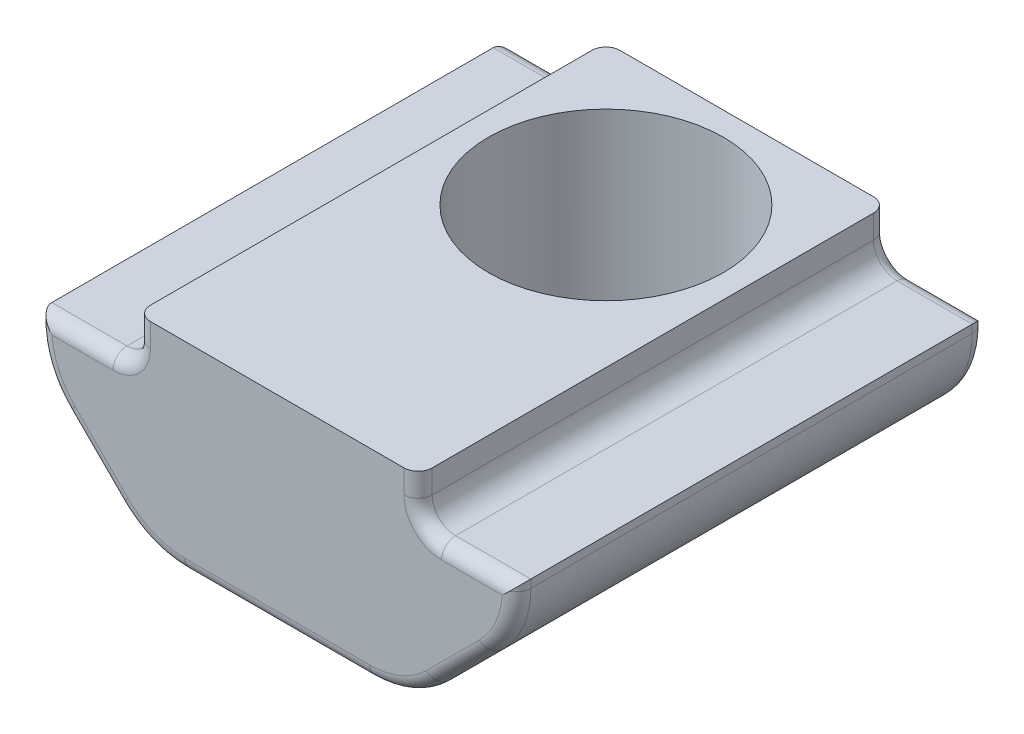
from build123d import *

# Parameters (mm, degrees)
EXTRUDE_1_DEPTH     = 10
FILLET_3_R          = 0.3
SKETCH_2_R          = 2.5
CUT_EXTRUDE_1_DEPTH = 6


with BuildPart() as part:
    # 草图1 → 凸台-拉伸1 (new body)
    with BuildSketch(Plane.XY):
        with BuildLine():
            Line((-3, 4.3), (3, 4.3))
            Line((3, 4.3), (3, 3.8))
            ThreePointArc((3, 3.8), (3.146446609, 3.446446609), (3.5, 3.3))
            Line((3.5, 3.3), (5.1, 3.3))
            Line((5.1, 3.3), (5.1, 3.128427125))
            ThreePointArc((5.1, 3.128427125), (4.947759065, 2.36306026), (4.514213562, 1.714213562))
            Line((4.514213562, 1.714213562), (3.385786438, 0.585786438))
            ThreePointArc((3.385786438, 0.585786438), (2.73693974, 0.152240935), (1.971572875, 0))
            Line((1.971572875, 0), (-1.971572875, 0))
            ThreePointArc((-1.971572875, 0), (-2.73693974, 0.152240935), (-3.385786438, 0.585786438))
            Line((-3.385786438, 0.585786438), (-4.514213562, 1.714213562))
            ThreePointArc((-4.514213562, 1.714213562), (-4.947759065, 2.36306026), (-5.1, 3.128427125))
            Line((-5.1, 3.128427125), (-5.1, 3.3))
            Line((-5.1, 3.3), (-3.5, 3.3))
            ThreePointArc((-3.5, 3.3), (-3.146446609, 3.446446609), (-3, 3.8))
            Line((-3, 3.8), (-3, 4.3))
        make_face()
    extrude(amount=EXTRUDE_1_DEPTH)

    # 圆角3
    # the kernel refuses this fillet: 0.3 mm, written as the material it takes off along each edge
    with BuildSketch(Plane(origin=(-3, 3.8, 10), x_dir=(0, 0, -1), z_dir=(0, 1, 0)), Plane(origin=(3, 5.05, 10), x_dir=(0, 0, -1), z_dir=(0, -1, 0))) as fillet_3_piece_1:
        with BuildLine():
            CenterArc((FILLET_3_R, -FILLET_3_R), FILLET_3_R, 90, 90)
            Line((0, -FILLET_3_R), (0, 0))
            Line((0, 0), (FILLET_3_R, 0))
        make_face()
    extrude(amount=1.25, mode=Mode.SUBTRACT)
    with BuildSketch(Plane(origin=(3, 5.05, 0), x_dir=(0, 0, 1), z_dir=(0, -1, 0)), Plane(origin=(-3, 3.8, 0), x_dir=(0, 0, 1), z_dir=(0, 1, 0))) as fillet_3_piece_2:
        with BuildLine():
            CenterArc((FILLET_3_R, FILLET_3_R), FILLET_3_R, 180, 90)
            Line((0, FILLET_3_R), (0, 0))
            Line((0, 0), (FILLET_3_R, 0))
        make_face()
    extrude(amount=1.25, mode=Mode.SUBTRACT)
    with BuildSketch(Plane(origin=(4.514213562, 1.714213562, 10), x_dir=(0, 0, -1), z_dir=(-0.7071067811865436, -0.7071067811865515, 0)), Plane(origin=(-3.385786438, 0.585786438, 10), x_dir=(0, 0, -1), z_dir=(-0.7071067811865436, 0.7071067811865515, 0))) as fillet_3_piece_3:
        with BuildLine():
            CenterArc((FILLET_3_R, -FILLET_3_R), FILLET_3_R, 90, 90)
            Line((0, -FILLET_3_R), (0, 0))
            Line((0, 0), (FILLET_3_R, 0))
        make_face()
    extrude(amount=1.595836944, mode=Mode.SUBTRACT)
    with BuildSketch(Plane(origin=(1.971572875, 2, 10), x_dir=(0.7071067811865542, -0.7071067811865409, 0), z_dir=(0.7071067811865409, 0.7071067811865542, 0))) as fillet_3_piece_4:
        with BuildLine():
            CenterArc((2 - FILLET_3_R, FILLET_3_R), FILLET_3_R, 270, 90)
            Line((2 - FILLET_3_R, 0), (2, 0))
            Line((2, 0), (2, FILLET_3_R))
        make_face()
    revolve(axis=Axis((1.971572875, 2, 10), (0, 0, -1)), revolution_arc=45, mode=Mode.SUBTRACT)
    with BuildSketch(Plane(origin=(1.971572875, 0, 10), x_dir=(0, 0, -1), z_dir=(-1, 0, 0))) as fillet_3_piece_5:
        with BuildLine():
            CenterArc((FILLET_3_R, -FILLET_3_R), FILLET_3_R, 90, 90)
            Line((0, -FILLET_3_R), (0, 0))
            Line((0, 0), (FILLET_3_R, 0))
        make_face()
    extrude(amount=3.943145751, mode=Mode.SUBTRACT)
    with BuildSketch(Plane(origin=(-1.971572875, 2, 10), x_dir=(0, -1, 0), z_dir=(1, 0, 0))) as fillet_3_piece_6:
        with BuildLine():
            CenterArc((2 - FILLET_3_R, FILLET_3_R), FILLET_3_R, 270, 90)
            Line((2 - FILLET_3_R, 0), (2, 0))
            Line((2, 0), (2, FILLET_3_R))
        make_face()
    revolve(axis=Axis((-1.971572875, 2, 10), (0, 0, -1)), revolution_arc=45, mode=Mode.SUBTRACT)
    with BuildSketch(Plane(origin=(-3.1, 3.128427125, 10), x_dir=(-0.7071067811865485, -0.7071067811865466, 0), z_dir=(0.7071067811865466, -0.7071067811865485, 0))) as fillet_3_piece_7:
        with BuildLine():
            CenterArc((2 - FILLET_3_R, FILLET_3_R), FILLET_3_R, 270, 90)
            Line((2 - FILLET_3_R, 0), (2, 0))
            Line((2, 0), (2, FILLET_3_R))
        make_face()
    revolve(axis=Axis((-3.1, 3.128427125, 10), (0, 0, -1)), revolution_arc=45, mode=Mode.SUBTRACT)
    with BuildSketch(Plane(origin=(-5.85, 3.3, 10), x_dir=(0, 0, -1), z_dir=(1, 0, 0)), Plane(origin=(3.5, 3.3, 10), x_dir=(0, 0, -1), z_dir=(1, 0, 0))) as fillet_3_piece_8:
        with BuildLine():
            CenterArc((FILLET_3_R, -FILLET_3_R), FILLET_3_R, 90, 90)
            Line((0, -FILLET_3_R), (0, 0))
            Line((0, 0), (FILLET_3_R, 0))
        make_face()
    extrude(amount=2.35, mode=Mode.SUBTRACT)
    with BuildSketch(Plane(origin=(-3.5, 3.8, 10), x_dir=(0, -1, 0), z_dir=(-1, 0, 0))) as fillet_3_piece_9:
        with BuildLine():
            CenterArc((0.5 + FILLET_3_R, -FILLET_3_R), FILLET_3_R, 90, 90)
            Line((0.5 + FILLET_3_R, 0), (0.5, 0))
            Line((0.5, 0), (0.5, -FILLET_3_R))
        make_face()
    revolve(axis=Axis((-3.5, 3.8, 10), (0, 0, 1)), revolution_arc=90, mode=Mode.SUBTRACT)
    with BuildSketch(Plane(origin=(3.5, 3.3, 0), x_dir=(0, 0, 1), z_dir=(1, 0, 0)), Plane(origin=(-5.85, 3.3, 0), x_dir=(0, 0, 1), z_dir=(1, 0, 0))) as fillet_3_piece_10:
        with BuildLine():
            CenterArc((FILLET_3_R, FILLET_3_R), FILLET_3_R, 180, 90)
            Line((0, FILLET_3_R), (0, 0))
            Line((0, 0), (FILLET_3_R, 0))
        make_face()
    extrude(amount=2.35, mode=Mode.SUBTRACT)
    with BuildSketch(Plane(origin=(3.5, 3.8, 0), x_dir=(-1, 0, 0), z_dir=(0, 1, 0))) as fillet_3_piece_11:
        with BuildLine():
            CenterArc((0.5 + FILLET_3_R, FILLET_3_R), FILLET_3_R, 180, 90)
            Line((0.5 + FILLET_3_R, 0), (0.5, 0))
            Line((0.5, 0), (0.5, FILLET_3_R))
        make_face()
    revolve(axis=Axis((3.5, 3.8, 0), (0, 0, 1)), revolution_arc=90, mode=Mode.SUBTRACT)
    with BuildSketch(Plane(origin=(-3.385786438, 0.585786438, 0), x_dir=(0, 0, 1), z_dir=(-0.7071067811865436, 0.7071067811865515, 0)), Plane(origin=(4.514213562, 1.714213562, 0), x_dir=(0, 0, 1), z_dir=(-0.7071067811865436, -0.7071067811865515, 0))) as fillet_3_piece_12:
        with BuildLine():
            CenterArc((FILLET_3_R, FILLET_3_R), FILLET_3_R, 180, 90)
            Line((0, FILLET_3_R), (0, 0))
            Line((0, 0), (FILLET_3_R, 0))
        make_face()
    extrude(amount=1.595836944, mode=Mode.SUBTRACT)
    with BuildSketch(Plane(origin=(-1.971572875, 2, 0), x_dir=(0, -1, 0), z_dir=(1, 0, 0))) as fillet_3_piece_13:
        with BuildLine():
            CenterArc((2 - FILLET_3_R, -FILLET_3_R), FILLET_3_R, 0, 90)
            Line((2 - FILLET_3_R, 0), (2, 0))
            Line((2, 0), (2, -FILLET_3_R))
        make_face()
    revolve(axis=Axis((-1.971572875, 2, 0), (0, 0, -1)), revolution_arc=45, mode=Mode.SUBTRACT)
    with BuildSketch(Plane(origin=(1.971572875, 0, 0), x_dir=(0, 0, 1), z_dir=(-1, 0, 0))) as fillet_3_piece_14:
        with BuildLine():
            CenterArc((FILLET_3_R, FILLET_3_R), FILLET_3_R, 180, 90)
            Line((0, FILLET_3_R), (0, 0))
            Line((0, 0), (FILLET_3_R, 0))
        make_face()
    extrude(amount=3.943145751, mode=Mode.SUBTRACT)
    with BuildSketch(Plane(origin=(1.971572875, 2, 0), x_dir=(0.7071067811865542, -0.7071067811865409, 0), z_dir=(0.7071067811865409, 0.7071067811865542, 0))) as fillet_3_piece_15:
        with BuildLine():
            CenterArc((2 - FILLET_3_R, -FILLET_3_R), FILLET_3_R, 0, 90)
            Line((2 - FILLET_3_R, 0), (2, 0))
            Line((2, 0), (2, -FILLET_3_R))
        make_face()
    revolve(axis=Axis((1.971572875, 2, 0), (0, 0, -1)), revolution_arc=45, mode=Mode.SUBTRACT)
    with BuildSketch(Plane(origin=(3.1, 3.128427125, 0), x_dir=(1, 0, 0), z_dir=(0, 1, 0))) as fillet_3_piece_16:
        with BuildLine():
            CenterArc((2 - FILLET_3_R, -FILLET_3_R), FILLET_3_R, 0, 90)
            Line((2 - FILLET_3_R, 0), (2, 0))
            Line((2, 0), (2, -FILLET_3_R))
        make_face()
    revolve(axis=Axis((3.1, 3.128427125, 0), (0, 0, -1)), revolution_arc=45, mode=Mode.SUBTRACT)
    with BuildSketch(Plane(origin=(3.1, 3.128427125, 10), x_dir=(1, 0, 0), z_dir=(0, 1, 0))) as fillet_3_piece_17:
        with BuildLine():
            CenterArc((2 - FILLET_3_R, FILLET_3_R), FILLET_3_R, 270, 90)
            Line((2 - FILLET_3_R, 0), (2, 0))
            Line((2, 0), (2, FILLET_3_R))
        make_face()
    revolve(axis=Axis((3.1, 3.128427125, 10), (0, 0, -1)), revolution_arc=45, mode=Mode.SUBTRACT)
    with BuildSketch(Plane(origin=(-3.1, 3.128427125, 0), x_dir=(-0.7071067811865485, -0.7071067811865466, 0), z_dir=(0.7071067811865466, -0.7071067811865485, 0))) as fillet_3_piece_18:
        with BuildLine():
            CenterArc((2 - FILLET_3_R, -FILLET_3_R), FILLET_3_R, 0, 90)
            Line((2 - FILLET_3_R, 0), (2, 0))
            Line((2, 0), (2, -FILLET_3_R))
        make_face()
    revolve(axis=Axis((-3.1, 3.128427125, 0), (0, 0, -1)), revolution_arc=45, mode=Mode.SUBTRACT)
    with BuildSketch(Plane(origin=(3.5, 3.8, 10), x_dir=(-1, 0, 0), z_dir=(0, 1, 0))) as fillet_3_piece_19:
        with BuildLine():
            CenterArc((0.5 + FILLET_3_R, -FILLET_3_R), FILLET_3_R, 90, 90)
            Line((0.5 + FILLET_3_R, 0), (0.5, 0))
            Line((0.5, 0), (0.5, -FILLET_3_R))
        make_face()
    revolve(axis=Axis((3.5, 3.8, 10), (0, 0, 1)), revolution_arc=90, mode=Mode.SUBTRACT)
    with BuildSketch(Plane(origin=(-3.5, 3.8, 0), x_dir=(0, -1, 0), z_dir=(-1, 0, 0))) as fillet_3_piece_20:
        with BuildLine():
            CenterArc((0.5 + FILLET_3_R, FILLET_3_R), FILLET_3_R, 180, 90)
            Line((0.5 + FILLET_3_R, 0), (0.5, 0))
            Line((0.5, 0), (0.5, FILLET_3_R))
        make_face()
    revolve(axis=Axis((-3.5, 3.8, 0), (0, 0, 1)), revolution_arc=90, mode=Mode.SUBTRACT)
    with BuildSketch(Plane(origin=(-5.1, 3.128427125, 0), x_dir=(0, 0, 1), z_dir=(0, 1, 0)), Plane(origin=(5.1, 4.05, 0), x_dir=(0, 0, 1), z_dir=(0, -1, 0))) as fillet_3_piece_21:
        with BuildLine():
            CenterArc((FILLET_3_R, FILLET_3_R), FILLET_3_R, 180, 90)
            Line((0, FILLET_3_R), (0, 0))
            Line((0, 0), (FILLET_3_R, 0))
        make_face()
    extrude(amount=0.921572875, mode=Mode.SUBTRACT)
    with BuildSketch(Plane(origin=(5.1, 4.05, 10), x_dir=(0, 0, -1), z_dir=(0, -1, 0)), Plane(origin=(-5.1, 3.128427125, 10), x_dir=(0, 0, -1), z_dir=(0, 1, 0))) as fillet_3_piece_22:
        with BuildLine():
            CenterArc((FILLET_3_R, -FILLET_3_R), FILLET_3_R, 90, 90)
            Line((0, -FILLET_3_R), (0, 0))
            Line((0, 0), (FILLET_3_R, 0))
        make_face()
    extrude(amount=0.921572875, mode=Mode.SUBTRACT)

    # 草图2 → 切除-拉伸1 (cut)
    with BuildSketch(Plane(origin=(0, 4.3, 0), x_dir=(1, 0, 0), z_dir=(0, 1, 0))):
        with Locations(Location((0, -3, 0), (0, 0, 270))):
            Circle(SKETCH_2_R)
    extrude(amount=-CUT_EXTRUDE_1_DEPTH, mode=Mode.SUBTRACT)


solid = part.part
